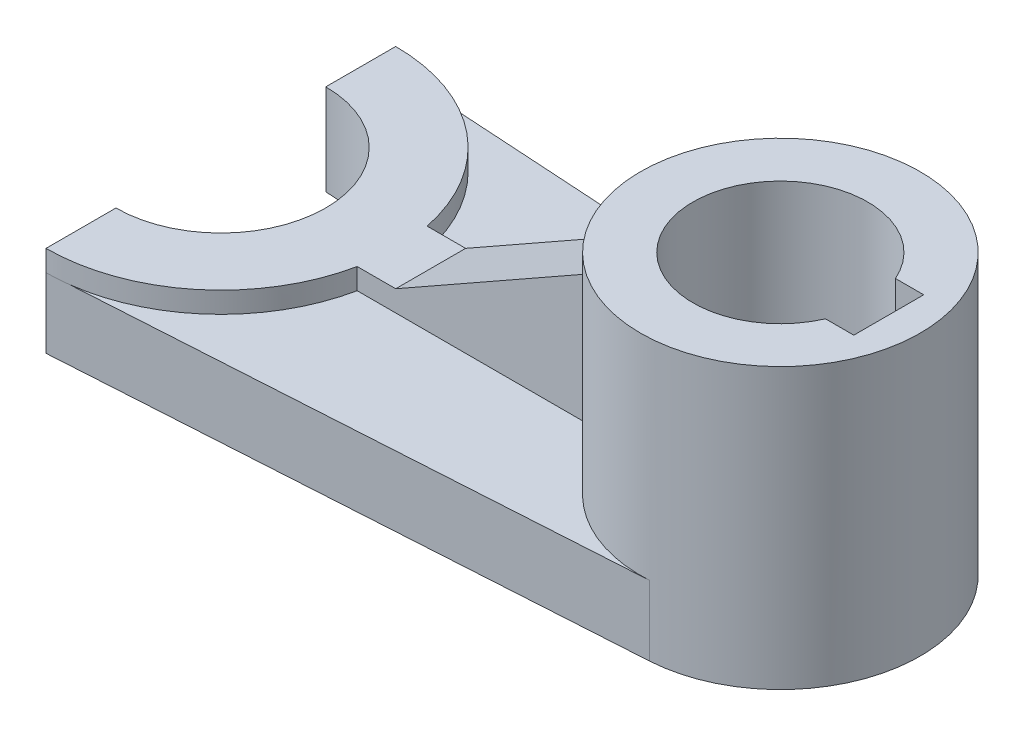
from build123d import *

# Parameters (mm, degrees)
EXTRUDE_3_DEPTH          = 10
EXTRUDE_7_DEPTH          = 3
CUT_EXTRUDE_3_DEPTH      = 86.986132552
CUT_EXTRUDE_3_DEPTH_BACK = 86.986132552
SKETCH_7_R               = 20
EXTRUDE_8_DEPTH          = 30
RIB_START                = -5
RIB_1_DEPTH              = 10
SKETCH_10_R              = 12.5
CUT_EXTRUDE_4_DEPTH      = 94.939421923
SKETCH_11_W              = 15.5
SKETCH_11_H              = 10
CUT_EXTRUDE_5_DEPTH      = 94.939421923


# Read off the part's stored shape, not the designer's step: 筋1
with BuildPart() as part:
    # 草图1 → 凸台-拉伸3 (new body)
    with BuildSketch(Plane(origin=(0, 0, 0), x_dir=(1, 0, 0), z_dir=(0, 1, 0))):
        with BuildLine():
            Line((-81.238014447, 25), (-81.238014447, -25))
            Line((-81.238014447, -25), (0, -19.96164623))
            ThreePointArc((0, -19.96164623), (18.761985553, 0), (0, 19.96164623))
            Line((0, 19.96164623), (-81.238014447, 25))
        make_face()
    extrude(amount=EXTRUDE_3_DEPTH)

    # 草图2 → 凸台-拉伸7 (add)
    with BuildSketch(Plane(origin=(0, 10, 0), x_dir=(1, 0, 0), z_dir=(0, 1, 0))):
        with BuildLine():
            Line((-81.238014447, 25), (-81.238014447, -25))
            ThreePointArc((-81.238014447, -25), (-56.238014447, 0), (-81.238014447, 25))
        make_face()
    extrude(amount=EXTRUDE_7_DEPTH)

    # 草图5 → 切除-拉伸3 (cut, two sides: drawn at the far end of the back side and taken through both)
    with BuildSketch(Plane(origin=(0, 13, 0), x_dir=(1, 0, 0), z_dir=(0, 1, 0)).offset(-CUT_EXTRUDE_3_DEPTH_BACK)):
        with BuildLine():
            Line((-306.644606732, 15), (-81.238014447, 15))
            ThreePointArc((-81.238014447, 15), (-66.238014447, 0), (-81.238014447, -15))
            Line((-81.238014447, -15), (-306.644606732, -15))
            Line((-306.644606732, -15), (-757.457791303, -15))
            Line((-757.457791303, -15), (-757.457791303, 15))
            Line((-757.457791303, 15), (-306.644606732, 15))
        make_face()
    extrude(amount=CUT_EXTRUDE_3_DEPTH + CUT_EXTRUDE_3_DEPTH_BACK, mode=Mode.SUBTRACT)

    # 草图7 → 凸台-拉伸8 (add)
    with BuildSketch(Plane(origin=(0, 10, 0), x_dir=(1, 0, 0), z_dir=(0, 1, 0))):
        with Locations(Location((-1.238014447, 0, 0), (0, 0, 86.451080997))):
            Circle(SKETCH_7_R)
    extrude(amount=EXTRUDE_8_DEPTH)

    # 筋1 outline → 筋1 (add)
    with BuildSketch(Plane.XY.offset(RIB_START)):
        Polygon((-51.238014447, 13), (-58, 13), (-58, 10), (-19, 10), (-19, 31.268208187), (-20.602931178, 30.359880519), align=None)
    extrude(amount=RIB_1_DEPTH)

    # 草图10 → 切除-拉伸4 (cut, through all)
    with BuildSketch(Plane(origin=(0, 40, 0), x_dir=(1, 0, 0), z_dir=(0, 1, 0))):
        with Locations(Location((-1.238014447, 0, 0), (0, 0, 270))):
            Circle(SKETCH_10_R)
    extrude(amount=-CUT_EXTRUDE_4_DEPTH, mode=Mode.SUBTRACT)

    # 草图11 → 切除-拉伸5 (cut, through all)
    with BuildSketch(Plane(origin=(0, 40, 0), x_dir=(1, 0, 0), z_dir=(0, 1, 0))):
        with Locations((6.511985553, 0)):
            Rectangle(SKETCH_11_W, SKETCH_11_H)
    extrude(amount=-CUT_EXTRUDE_5_DEPTH, mode=Mode.SUBTRACT)


solid = part.part
